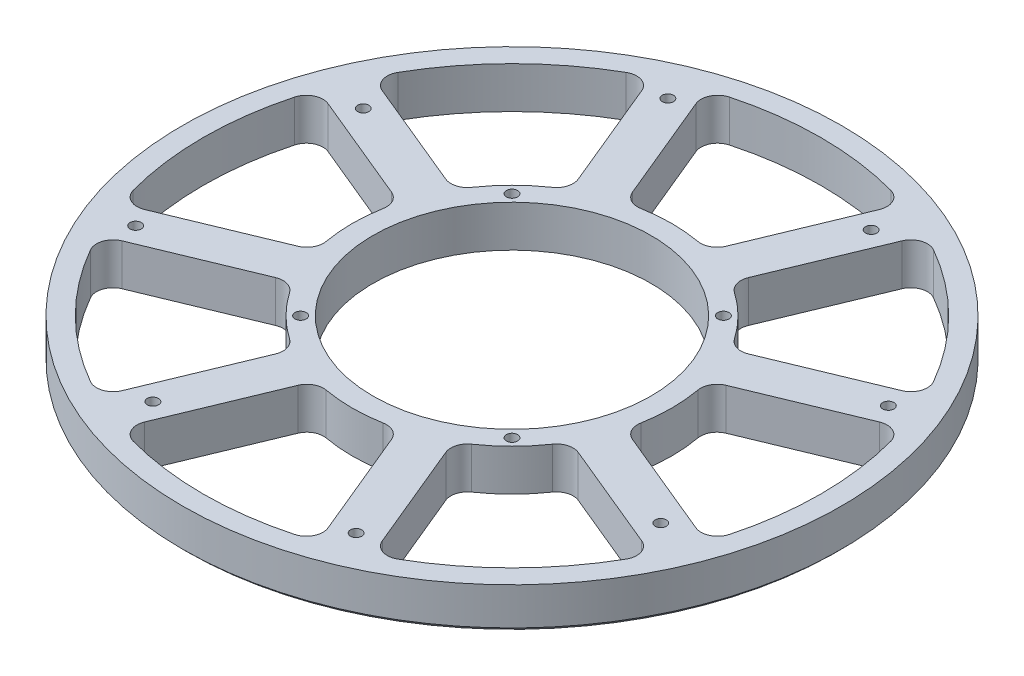
from build123d import *

# Parameters (mm, degrees)
SKETCH2_W                = 79.375
SKETCH2_H                = 10
F_6_32_TAPPED_HOLE1_D    = 2.7051
CIRPATTERN3_COUNT        = 4
CUT_EXTRUDE1_DEPTH       = 113.697742879
FILLET1_R                = 4
CIRPATTERN4_COUNT        = 8
FILLET1_OF_CIRPATTERN4_R = 4
CHAMFER2_SIZE            = 1
SKETCH9_R                = 33.5
CUT_EXTRUDE2_DEPTH       = 113.697742879


with BuildPart() as part:
    # Sketch2 → Revolve1 (revolve)
    with BuildSketch(Plane(origin=(0, 0, 0), x_dir=(0, 0, -1), z_dir=(1, 0, 0))):
        with Locations((-39.6875, 5)):
            Rectangle(SKETCH2_W, SKETCH2_H)
    revolve(axis=Axis((0, -0.5, 0), (0, 1, 0)))

    # #6-32 Tapped Hole1 (through all)
    with Locations(Plane(origin=(0, 10, 0), x_dir=(1, 0, 0), z_dir=(0, 1, 0))):
        with Locations((-26.54866312, 64.094142568), (-61.160825052, 25.333643223), (-25.455844123, 25.455844123)):
            f_6_32_tapped_hole1 = Hole(F_6_32_TAPPED_HOLE1_D / 2)

    # CirPattern3: #6-32 Tapped Hole1 ×4 about axis
    cirpattern3_axis = Axis((0, -0.5, 0), (0, 1, 0))
    for i in range(1, CIRPATTERN3_COUNT):
        add(f_6_32_tapped_hole1.rotate(cirpattern3_axis, i * 360 / CIRPATTERN3_COUNT), mode=Mode.SUBTRACT)

    # Sketch8 → Cut-Extrude1 (cut, through all)
    with BuildSketch(Plane(origin=(0, 10, 0), x_dir=(1, 0, 0), z_dir=(0, 1, 0))):
        with BuildLine():
            Line((-9.989138252, 37.181542692), (-23.778293243, 70.471507685))
            ThreePointArc((-23.778293243, 70.471507685), (0, 74.375), (23.778293243, 70.471507685))
            Line((23.778293243, 70.471507685), (9.989138252, 37.181542692))
            ThreePointArc((9.989138252, 37.181542692), (0, 38.5), (-9.989138252, 37.181542692))
        make_face()
    cut_extrude1 = extrude(amount=-CUT_EXTRUDE1_DEPTH, mode=Mode.SUBTRACT)

    # Fillet1
    fillet1_edges = [part.edges().sort_by_distance(p)[0] for p in [
        (9.989138252, 5, -37.181542692),
        (23.778293243, 5, -70.471507685),
        (-9.989138252, 5, -37.181542692),
        (-23.778293243, 5, -70.471507685),
    ]]
    fillet(fillet1_edges, radius=FILLET1_R)

    # CirPattern4: Cut-Extrude1 ×8 about axis
    cirpattern4_axis = Axis((0, -0.5, 0), (0, 1, 0))
    for i in range(1, CIRPATTERN4_COUNT):
        add(cut_extrude1.rotate(cirpattern4_axis, i * 360 / CIRPATTERN4_COUNT), mode=Mode.SUBTRACT)

    # Fillet1 of CirPattern4
    fillet1_of_cirpattern4_edges = [part.edges().sort_by_distance(p)[0] for p in [
        (-19.227933577, 5, -33.354708369),
        (-33.017088568, 5, -66.644673362),
        (-33.354708369, 5, -19.227933577),
        (-66.644673362, 5, -33.017088568),
        (-37.181542692, 5, -9.989138252),
        (-70.471507685, 5, -23.778293243),
        (-37.181542692, 5, 9.989138252),
        (-70.471507685, 5, 23.778293243),
        (-33.354708369, 5, 19.227933577),
        (-66.644673362, 5, 33.017088568),
        (-19.227933577, 5, 33.354708369),
        (-33.017088568, 5, 66.644673362),
        (-9.989138252, 5, 37.181542692),
        (-23.778293243, 5, 70.471507685),
        (9.989138252, 5, 37.181542692),
        (23.778293243, 5, 70.471507685),
        (19.227933577, 5, 33.354708369),
        (33.017088568, 5, 66.644673362),
        (33.354708369, 5, 19.227933577),
        (66.644673362, 5, 33.017088568),
        (37.181542692, 5, 9.989138252),
        (70.471507685, 5, 23.778293243),
        (37.181542692, 5, -9.989138252),
        (70.471507685, 5, -23.778293243),
        (33.354708369, 5, -19.227933577),
        (66.644673362, 5, -33.017088568),
        (19.227933577, 5, -33.354708369),
        (33.017088568, 5, -66.644673362),
    ]]
    fillet(fillet1_of_cirpattern4_edges, radius=FILLET1_OF_CIRPATTERN4_R)

    # Chamfer2
    chamfer2_edges = [part.edges().sort_by_distance(p)[0] for p in [
        (0, 0, -79.375),
    ]]
    chamfer(chamfer2_edges, length=CHAMFER2_SIZE)

    # Sketch9 → Cut-Extrude2 (cut, through all)
    with BuildSketch(Plane(origin=(0, 10, 0), x_dir=(1, 0, 0), z_dir=(0, 1, 0))):
        Circle(SKETCH9_R)
    extrude(amount=-CUT_EXTRUDE2_DEPTH, mode=Mode.SUBTRACT)


solid = part.part
